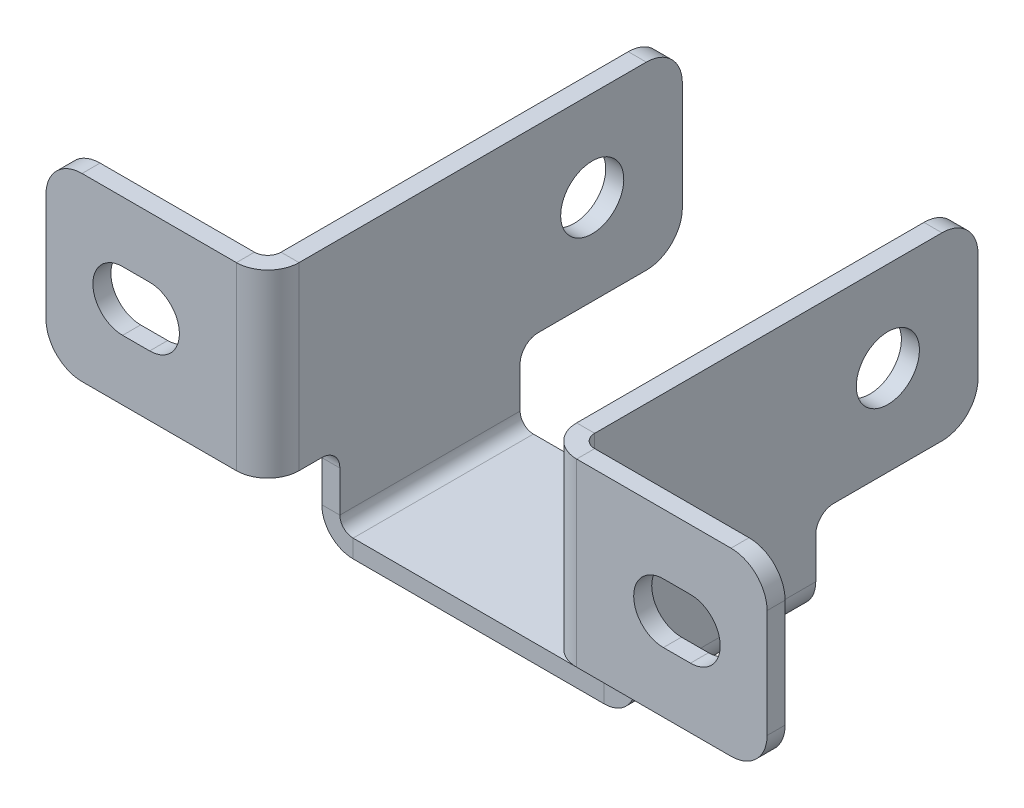
from build123d import *

# Parameters (mm, degrees)
SKETCH1_W                    = 7.7
SKETCH1_H                    = 10
BASE_FLANGE1_DEPTH           = 1
EDGE_FLANGE1_STRIP_W         = 5.4732
EDGE_FLANGE1_STRIP_H         = 1
EDGE_FLANGE1_STRIP_CUT_DEPTH = 10
EDGE_FLANGE1_DEPTH           = 10
SKETCH11_W                   = 23
SKETCH11_H                   = 10
TAB1_DEPTH                   = 1
FILLET1_R                    = 1
FILLET2_R                    = 2
SKETCH15_R                   = 1.75
CUT_EXTRUDE1_DEPTH           = 22.626141588
EDGE_FLANGE2_STRIP_W         = 5.4732
EDGE_FLANGE2_STRIP_H         = 1
EDGE_FLANGE2_STRIP_CUT_DEPTH = 10
EDGE_FLANGE2_DEPTH           = 10
CUT_EXTRUDE2_DEPTH           = 33.86335345
FILLET3_R                    = 2


# Sheet-metal steps are written as plain solids
with BuildPart() as part:
    # Sketch1 → Base-Flange1 (new body)
    with BuildSketch(Plane(origin=(0, 0, 0), x_dir=(1, 0, 0), z_dir=(0, 1, 0))):
        with Locations((3.85, 0)):
            Rectangle(SKETCH1_W, SKETCH1_H)
    extrude(amount=-BASE_FLANGE1_DEPTH)

    # Edge-Flange1 strip (across the edge) → Edge-Flange1 strip cut (cut)
    with BuildSketch(Plane(origin=(7.7, 0, 5), x_dir=(-1, 0, 0), z_dir=(0, 0, -1))):
        with Locations((-2, -0.5)):
            Rectangle(EDGE_FLANGE1_STRIP_W, EDGE_FLANGE1_STRIP_H)
    extrude(amount=EDGE_FLANGE1_STRIP_CUT_DEPTH, mode=Mode.SUBTRACT)

    # Edge-Flange1 section (across the edge) → Edge-Flange1 (add)
    with BuildSketch(Plane(origin=(7.7, 0, 5), x_dir=(-1, 0, 0), z_dir=(0, 0, -1))):
        with BuildLine():
            Line((-1, 0.7366), (-1, 4))
            Line((-1, 4), (0, 4))
            Line((0, 4), (0, 0.7366))
            ThreePointArc((0, 0.7366), (0.215745145, 0.215745145), (0.7366, 0))
            Line((0.7366, 0), (0.7366, -1))
            ThreePointArc((0.7366, -1), (-0.491361636, -0.491361636), (-1, 0.7366))
        make_face()
    extrude(amount=EDGE_FLANGE1_DEPTH)

    # Sketch11 → Tab1 (add)
    with BuildSketch(Plane(origin=(8.7, 0, 0), x_dir=(0, 0, -1), z_dir=(1, 0, 0))):
        with Locations((2.5, 9)):
            Rectangle(SKETCH11_W, SKETCH11_H)
    extrude(amount=-TAB1_DEPTH)

    # Fillet1
    fillet1_edges = [part.edges().sort_by_distance(p)[0] for p in [
        (8.2, 4, 5),
        (8.2, 4, -5),
    ]]
    fillet(fillet1_edges, radius=FILLET1_R)

    # Fillet2
    fillet2_edges = [part.edges().sort_by_distance(p)[0] for p in [
        (8.2, 14, -14),
        (8.2, 4, -14),
    ]]
    fillet(fillet2_edges, radius=FILLET2_R)

    # Sketch15 → Cut-Extrude1 (cut, through all)
    with BuildSketch(Plane(origin=(8.7, 0, 0), x_dir=(0, 0, -1), z_dir=(1, 0, 0))):
        with Locations(Location((9, 9, 0), (0, 0, 90))):
            Circle(SKETCH15_R)
    extrude(amount=-CUT_EXTRUDE1_DEPTH, mode=Mode.SUBTRACT)

    # Edge-Flange2 strip (across the edge) → Edge-Flange2 strip cut (cut)
    with BuildSketch(Plane(origin=(8.7, 14, 9), x_dir=(0, 0, -1), z_dir=(0, -1, 0))):
        with Locations((-1, -0.5)):
            Rectangle(EDGE_FLANGE2_STRIP_W, EDGE_FLANGE2_STRIP_H)
    extrude(amount=EDGE_FLANGE2_STRIP_CUT_DEPTH, mode=Mode.SUBTRACT)

    # Edge-Flange2 section (across the edge) → Edge-Flange2 (add)
    with BuildSketch(Plane(origin=(8.7, 14, 9), x_dir=(0, 0, -1), z_dir=(0, -1, 0))):
        with BuildLine():
            Line((0, 0.7366), (0, 11.3))
            Line((0, 11.3), (1, 11.3))
            Line((1, 11.3), (1, 0.7366))
            ThreePointArc((1, 0.7366), (1.215745145, 0.215745145), (1.7366, 0))
            Line((1.7366, 0), (1.7366, -1))
            ThreePointArc((1.7366, -1), (0.508638364, -0.491361636), (0, 0.7366))
        make_face()
    extrude(amount=EDGE_FLANGE2_DEPTH)

    # Sketch23 → Cut-Extrude2 (cut, through all)
    with BuildSketch(Plane(origin=(0, 0, 8), x_dir=(-1, 0, 0), z_dir=(0, 0, -1))):
        with BuildLine():
            Line((-15.75, 10.65), (-14.25, 10.65))
            ThreePointArc((-14.25, 10.65), (-12.6, 9), (-14.25, 7.35))
            Line((-14.25, 7.35), (-15.75, 7.35))
            ThreePointArc((-15.75, 7.35), (-17.4, 9), (-15.75, 10.65))
        make_face()
    extrude(amount=-CUT_EXTRUDE2_DEPTH, mode=Mode.SUBTRACT)

    # Fillet3
    fillet3_edges = [part.edges().sort_by_distance(p)[0] for p in [
        (20, 14, 8.5),
        (20, 4, 8.5),
    ]]
    fillet(fillet3_edges, radius=FILLET3_R)

    # Mirror1: part across plane


with BuildPart() as part_1:
    add(part.part)
    add(part.part.mirror(Plane(origin=(0, -1, -5), x_dir=(0, 0, 1), z_dir=(-1, 0, 0))))


solid = part_1.part
